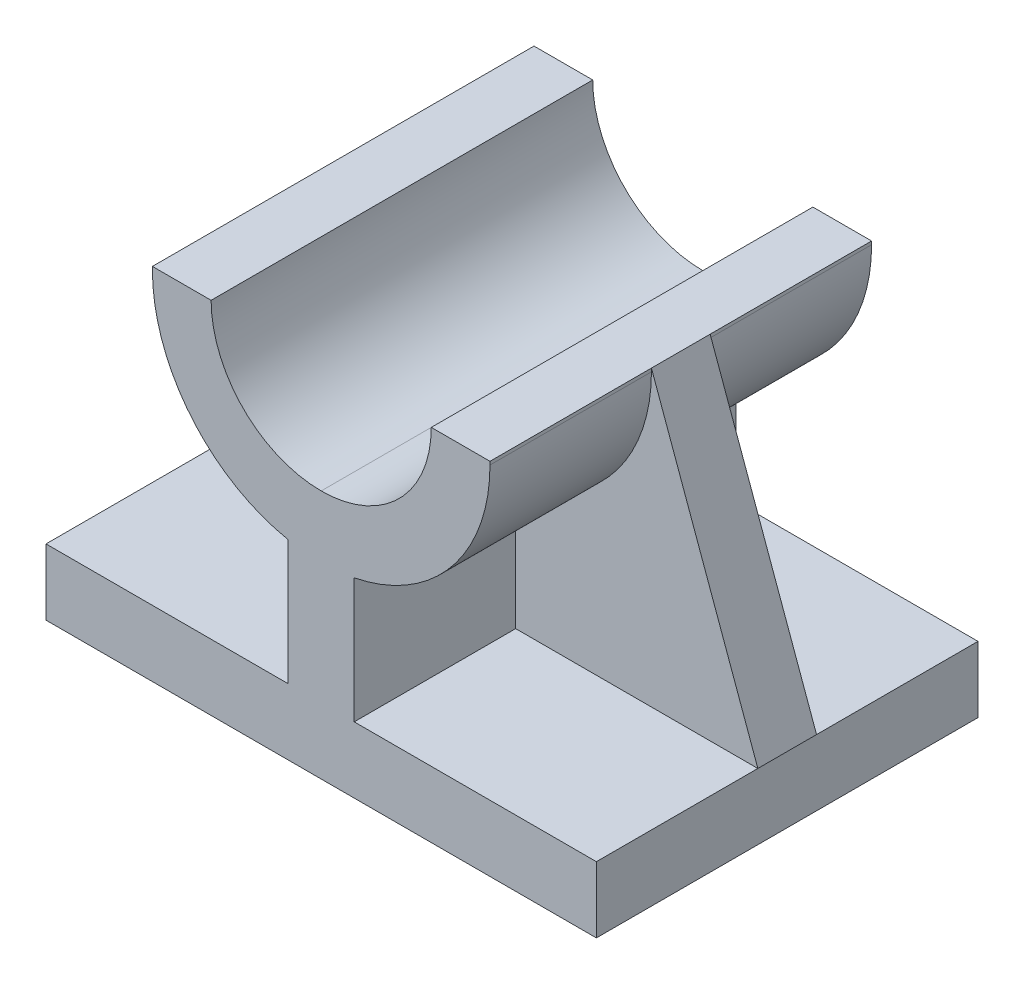
from build123d import *

# Parameters (mm, degrees)
SKETCH1_W           = 190.5
SKETCH1_H           = 132.08
BOSS_EXTRUDE1_DEPTH = 22.86
SKETCH2_W           = 116.84
SKETCH2_H           = 132.08
BOSS_EXTRUDE2_DEPTH = 101.6
SKETCH3_W           = 20.32
SKETCH3_H           = 101.6
BOSS_EXTRUDE3_DEPTH = 36.83
SKETCH5_W           = 55.88
SKETCH5_H           = 43.18
CUT_EXTRUDE1_DEPTH  = 46.99
SKETCH4_W           = 55.88
SKETCH4_H           = 43.18
CUT_EXTRUDE2_DEPTH  = 46.99
SKETCH6_W           = 132.08
SKETCH6_H           = 43.18
CUT_EXTRUDE3_DEPTH  = 46.99
SKETCH10_W          = 76.2
SKETCH10_H          = 132.08
CUT_EXTRUDE4_DEPTH  = 38.1
CHAMFER1_SIZE       = 36.83
CHAMFER1_SIZE2      = 101.6
FILLET1_R           = 58.42
FILLET2_R           = 38.1


# Some blends are built 0.0001 mm under size
with BuildPart() as part:
    # Sketch1 → Boss-Extrude1 (new body)
    with BuildSketch(Plane(origin=(0, 0, 0), x_dir=(1, 0, 0), z_dir=(0, 1, 0))):
        with Locations((95.25, -66.04)):
            Rectangle(SKETCH1_W, SKETCH1_H)
    extrude(amount=BOSS_EXTRUDE1_DEPTH)

    # Sketch2 → Boss-Extrude2 (add)
    with BuildSketch(Plane(origin=(0, 22.86, 0), x_dir=(1, 0, 0), z_dir=(0, 1, 0))):
        with Locations((95.25, -66.04)):
            Rectangle(SKETCH2_W, SKETCH2_H)
    extrude(amount=BOSS_EXTRUDE2_DEPTH)

    # Sketch3 → Boss-Extrude3 (add)
    with BuildSketch(Plane(origin=(153.67, 0, 0), x_dir=(0, 0, -1), z_dir=(1, 0, 0))):
        with Locations((-66.04, 73.66)):
            Rectangle(SKETCH3_W, SKETCH3_H)
    extrude(amount=BOSS_EXTRUDE3_DEPTH)

    # Sketch5 → Cut-Extrude1 (cut)
    with BuildSketch(Plane(origin=(153.67, 0, 0), x_dir=(0, 0, -1), z_dir=(1, 0, 0))):
        with Locations((-27.94, 44.45)):
            Rectangle(SKETCH5_W, SKETCH5_H)
    extrude(amount=-CUT_EXTRUDE1_DEPTH, mode=Mode.SUBTRACT)

    # Sketch4 → Cut-Extrude2 (cut)
    with BuildSketch(Plane(origin=(153.67, 0, 0), x_dir=(0, 0, -1), z_dir=(1, 0, 0))):
        with Locations((-104.14, 44.45)):
            Rectangle(SKETCH4_W, SKETCH4_H)
    extrude(amount=-CUT_EXTRUDE2_DEPTH, mode=Mode.SUBTRACT)

    # Sketch6 → Cut-Extrude3 (cut)
    with BuildSketch(Plane.ZY.offset(-36.83)):
        with Locations((66.04, 44.45)):
            Rectangle(SKETCH6_W, SKETCH6_H)
    extrude(amount=-CUT_EXTRUDE3_DEPTH, mode=Mode.SUBTRACT)

    # Sketch10 → Cut-Extrude4 (cut)
    with BuildSketch(Plane(origin=(0, 124.46, 0), x_dir=(1, 0, 0), z_dir=(0, 1, 0))):
        with Locations((95.25, -66.04)):
            Rectangle(SKETCH10_W, SKETCH10_H)
    extrude(amount=-CUT_EXTRUDE4_DEPTH, mode=Mode.SUBTRACT)

    # Chamfer1
    chamfer1_edges = [part.edges().sort_by_distance(p)[0] for p in [
        (190.5, 124.46, 66.04),
    ]]
    chamfer1_side = [part.faces().sort_by_distance(p)[0] for p in [
        (149.740639098, 124.46, 66.04),
    ]]
    chamfer(chamfer1_edges, length=CHAMFER1_SIZE, length2=CHAMFER1_SIZE2, reference=chamfer1_side[0])

    # Fillet1
    # the kernel refuses this fillet: 58.42 mm, written as the material it takes off along each edge
    with BuildSketch(Plane(origin=(36.83, 66.04, 275.307343322), x_dir=(0, 1, 0), z_dir=(0, 0, -1))) as fillet1_piece_1:
        with BuildLine():
            CenterArc((57.290937329, 58.42), FILLET1_R, 191.282824288, 78.717175712)
            Line((0, 46.99), (-1.145818747, 46.7614))
            ThreePointArc((-1.145818747, 46.7614), (-1.1684, 23.495), (-1.1684, 0))
            Line((-1.1684, 0), (0, -1.1684))
            Line((0, -1.1684), (57.290937329, -1.1684))
            Line((57.290937329, -1.1684), (57.290937329, 0))
        make_face()
    extrude(amount=418.534686643, mode=Mode.SUBTRACT)
    with BuildSketch(Plane(origin=(153.67, 66.04, -143.227343322), x_dir=(-1, 0, 0), z_dir=(0, 0, 1))) as fillet1_piece_2:
        with BuildLine():
            CenterArc((58.42, -57.290937329), FILLET1_R, 101.282824288, 78.717175712)
            Line((0, -57.290937329), (-1.1684, -57.290937329))
            Line((-1.1684, -57.290937329), (-1.1684, 0))
            Line((-1.1684, 0), (0, 1.1684))
            ThreePointArc((0, 1.1684), (23.495, 1.1684), (46.7614, 1.145818747))
            Line((46.7614, 1.145818747), (46.99, 0))
        make_face()
    extrude(amount=199.107343322, mode=Mode.SUBTRACT)
    with BuildSketch(Plane(origin=(153.67, 66.04, -143.227343322), x_dir=(-1, 0, 0), z_dir=(0, 0, 1))) as fillet1_piece_3_section:
        with BuildLine():
            CenterArc((58.42, -57.290937329), FILLET1_R, 101.282824288, 78.717175712)
            Line((0, -57.290937329), (-1.1684, -57.290937329))
            Line((-1.1684, -57.290937329), (-1.1684, 0))
            Line((-1.1684, 0), (0, 1.1684))
            ThreePointArc((0, 1.1684), (23.495, 1.1684), (46.7614, 1.145818747))
            Line((46.7614, 1.145818747), (46.99, 0))
        make_face()
    fillet1_piece_3 = extrude(amount=342.334686643, mode=Mode.PRIVATE)
    fillet1_piece_3 = split(fillet1_piece_3, bisect_by=Plane(origin=(141.963702204, 79.396824985, 76.2), z_dir=(0, 0, 1)), keep=Keep.TOP, mode=Mode.PRIVATE)
    add(fillet1_piece_3, mode=Mode.SUBTRACT)
    with BuildSketch(Plane(origin=(153.67, 66.04, 275.307343322), x_dir=(0, 1, 0), z_dir=(0, 0, -1))) as fillet1_piece_4:
        with BuildLine():
            CenterArc((57.290937329, -58.42), FILLET1_R, 90, 78.717175712)
            Line((0, -46.99), (-1.145818747, -46.7614))
            ThreePointArc((-1.145818747, -46.7614), (-1.1684, -23.495), (-1.1684, 0))
            Line((-1.1684, 0), (0, 1.1684))
            Line((0, 1.1684), (57.290937329, 1.1684))
            Line((57.290937329, 1.1684), (57.290937329, 0))
        make_face()
    extrude(amount=199.107343322, mode=Mode.SUBTRACT)
    with BuildSketch(Plane(origin=(153.67, 66.04, 275.307343322), x_dir=(0, 1, 0), z_dir=(0, 0, -1))) as fillet1_piece_5_section:
        with BuildLine():
            CenterArc((57.290937329, -58.42), FILLET1_R, 90, 78.717175712)
            Line((0, -46.99), (-1.145818747, -46.7614))
            ThreePointArc((-1.145818747, -46.7614), (-1.1684, -23.495), (-1.1684, 0))
            Line((-1.1684, 0), (0, 1.1684))
            Line((0, 1.1684), (57.290937329, 1.1684))
            Line((57.290937329, 1.1684), (57.290937329, 0))
        make_face()
    fillet1_piece_5 = extrude(amount=342.334686643, mode=Mode.PRIVATE)
    fillet1_piece_5 = split(fillet1_piece_5, bisect_by=Plane(origin=(141.963702204, 79.396824985, 55.88), z_dir=(0, 0, -1)), keep=Keep.TOP, mode=Mode.PRIVATE)
    add(fillet1_piece_5, mode=Mode.SUBTRACT)

    # Fillet2
    fillet2_edges = [part.edges().sort_by_distance(p)[0] for p in [
        (133.35, 86.36, 66.04),
        (57.15, 86.36, 66.04),
    ]]
    fillet(fillet2_edges, radius=FILLET2_R - 0.0001)  # a hair under: the kernel refuses the full size


solid = part.part
